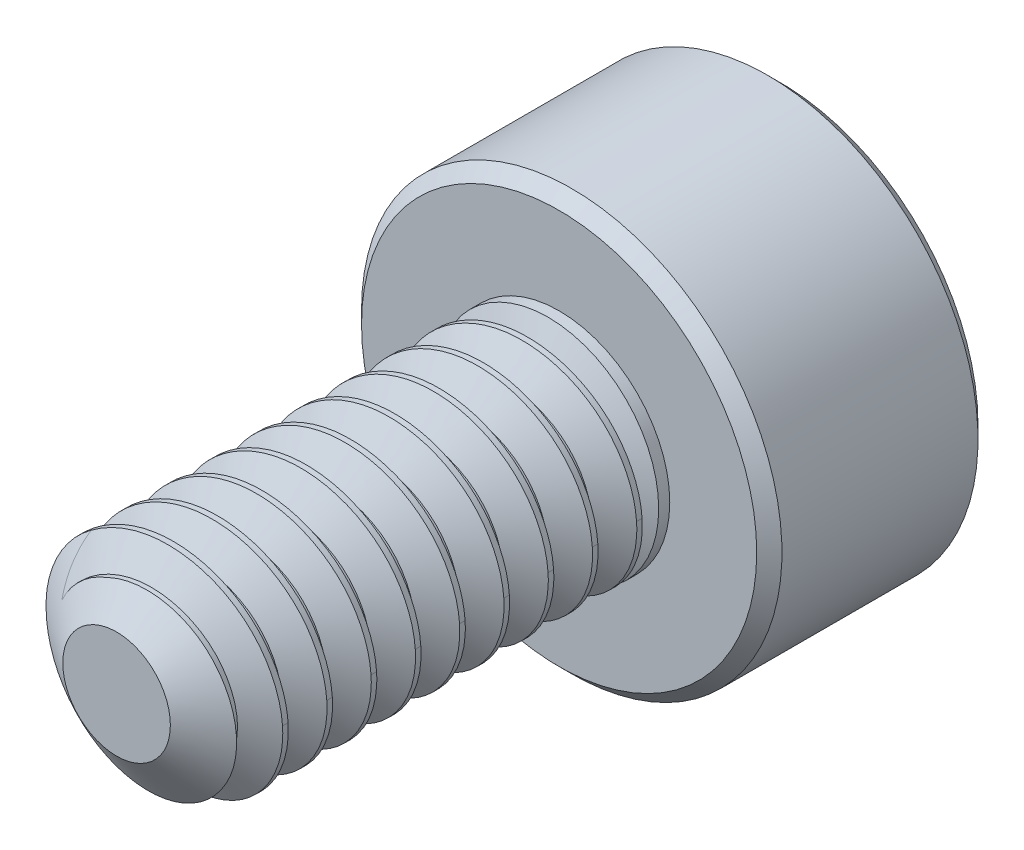
from build123d import *

# Parameters (mm, degrees)
SKETCH1_R          = 1
EXTRUDE1_DEPTH     = 4
CUT_SWEEP1_PITCH   = 0.4
SKETCH6_R          = 1.9
EXTRUDE2_DEPTH     = 2
CUT_EXTRUDE1_DEPTH = 1.125
CHAMFER1_SIZE      = 0.114


with BuildPart() as part:
    # Sketch1 → Extrude1 (new body)
    with BuildSketch(Plane.XY):
        Circle(SKETCH1_R)
    extrude(amount=-EXTRUDE1_DEPTH)

    # Cut-Sweep1: the profile of Sketch3 profile screwed along a right-hand helix of 11 turns, 6 arcs to a turn; built about Z, then put on its axis
    cut_sweep1_z = Axis((0, 0, 0), (0, 0, 1))
    cut_sweep1_corners = [(1.0003, 0, -0.350173205), (0.740192379, 0, -0.2), (0.740192379, 0, -0.15), (1.0003, 0, 0.000173205)]
    with BuildLine(mode=Mode.PRIVATE) as cut_sweep1_profile:
        Line(cut_sweep1_corners[0], cut_sweep1_corners[1])
        Line(cut_sweep1_corners[1], cut_sweep1_corners[2])
        Line(cut_sweep1_corners[2], cut_sweep1_corners[3])
        Line(cut_sweep1_corners[3], cut_sweep1_corners[0])
    cut_sweep1_cap = Face(cut_sweep1_profile.wire())
    cut_sweep1_turn_angles = [0, 30, 60, 90, 120, 150, 180, 210, 240, 270, 300, 330, 360]
    cut_sweep1_turn_weights = [1, 0.8660254037844387, 1, 0.8660254037844387, 1, 0.8660254037844387, 1, 0.8660254037844387, 1, 0.8660254037844387, 1, 0.8660254037844387, 1]
    cut_sweep1_turn_rails = [Edge.make_bspline([Vector(p[0], p[1], 0).rotate(cut_sweep1_z, cut_sweep1_turn_angles[k]) / cut_sweep1_turn_weights[k] + Vector(0, 0, p[2] + CUT_SWEEP1_PITCH * cut_sweep1_turn_angles[k] / 360) for k in range(13)], [0, 0, 0, 1, 1, 2, 2, 3, 3, 4, 4, 5, 5, 6, 6, 6], 2, cut_sweep1_turn_weights) for p in cut_sweep1_corners]
    cut_sweep1_turn_sides = [Face.make_surface_from_curves(cut_sweep1_turn_rails[p[0]], cut_sweep1_turn_rails[p[1]]) for p in [(0, 1), (1, 2), (2, 3), (3, 0)]]
    cut_sweep1 = Plane(origin=(0, 0, 0), x_dir=(0, 1, 0), z_dir=(0, 0, -1)) * Solid(Shell([*[p.moved(Location((0, 0, CUT_SWEEP1_PITCH * i))) for i in range(11) for p in cut_sweep1_turn_sides], cut_sweep1_cap, cut_sweep1_cap.rotate(cut_sweep1_z, 3960).moved(Location((0, 0, CUT_SWEEP1_PITCH * 3960 / 360)))]))
    add(cut_sweep1, mode=Mode.SUBTRACT)

    # Sketch4 → Cut-Revolve1 (revolve, cut)
    with BuildSketch(Plane(origin=(0, 0, 0), x_dir=(0, 0, -1), z_dir=(1, 0, 0)), mode=Mode.PRIVATE) as cut_revolve1_sk:
        Polygon((0.35977197, 1), (0, 0.486192379), (0, 1), align=None)
    revolve(cut_revolve1_sk.sketch.rotate(Axis((0, 0, 0), (0, 0, -1)), 278.428757719), axis=Axis((0, 0, 0), (0, 0, -1)), mode=Mode.SUBTRACT)

    # Sketch6 → Extrude2 (add)
    with BuildSketch(Plane(origin=(0, 0, -4), x_dir=(-1, 0, 0), z_dir=(0, 0, -1))):
        Circle(SKETCH6_R)
    extrude(amount=EXTRUDE2_DEPTH)

    # Sketch7 → Cut-Extrude1 (cut)
    with BuildSketch(Plane(origin=(0, 0, -6), x_dir=(-1, 0, 0), z_dir=(0, 0, -1))):
        Polygon((0, 0.866025404), (-0.75, 0.433012702), (-0.75, -0.433012702), (0, -0.866025404), (0.75, -0.433012702), (0.75, 0.433012702), align=None)
    extrude(amount=-CUT_EXTRUDE1_DEPTH, mode=Mode.SUBTRACT)

    # Cut-Extrude2 cone 1 section (through the dimple's axis) → Cut-Extrude2 (revolve, cut)
    with BuildSketch(Plane(origin=(0, 0, -6), x_dir=(0, 1, 0), z_dir=(1, 0, 0))):
        Polygon((0, 0), (0.866025404, 0), (0, 0.866025404), align=None)
    revolve(axis=Axis((0, 0, -6), (0, 0, 1)), mode=Mode.SUBTRACT)

    # Chamfer1
    chamfer1_edges = [part.edges().sort_by_distance(p)[0] for p in [
        (1.9, 0, -4),
        (1.9, 0, -6),
    ]]
    chamfer(chamfer1_edges, length=CHAMFER1_SIZE)

    # Sketch10 → Revolve1 (revolve)
    with BuildSketch(Plane(origin=(0, 0, 0), x_dir=(0, 0, -1), z_dir=(1, 0, 0)), mode=Mode.PRIVATE) as revolve1_sk:
        Polygon((4, 1), (4, 0), (3.485786438, 0), (3.9, 1), align=None)
    revolve(revolve1_sk.sketch.rotate(Axis((0, 0, -4), (0, 0, 1)), 270), axis=Axis((0, 0, -4), (0, 0, 1)))


solid = part.part
